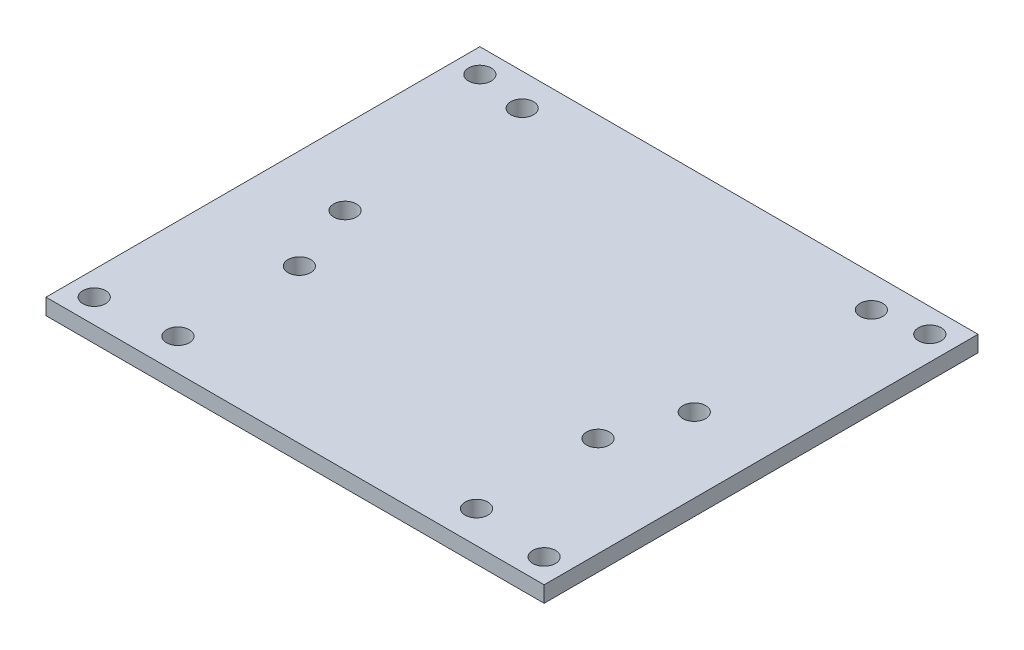
from build123d import *

# Parameters (mm, degrees)
SKETCH1_W            = 98.425
SKETCH1_H            = 85.725
BOSS_EXTRUDE1_DEPTH  = 3.175
M3_CLEARANCE_HOLE1_D = 4.5
M3_CLEARANCE_HOLE2_D = 4.5


with BuildPart() as part:
    # Sketch1 → Boss-Extrude1 (new body)
    with BuildSketch(Plane(origin=(0, 0, 0), x_dir=(1, 0, 0), z_dir=(0, 1, 0))):
        Rectangle(SKETCH1_W, SKETCH1_H)
    extrude(amount=BOSS_EXTRUDE1_DEPTH)

    # M3 Clearance Hole1 (through all)
    with Locations(Plane(origin=(-44.45, 0, 38.1), x_dir=(0, 0, -1), z_dir=(0, -1, 0))):
        with Locations((0, 0), (0, 88.9), (76.2, 0), (76.2, 88.9)):
            Hole(M3_CLEARANCE_HOLE1_D / 2)

    # M3 Clearance Hole2 (through all)
    with Locations(Plane(origin=(-29.5, 3.175, 36.5125), x_dir=(0, 0, 1), z_dir=(0, 1, 0))):
        with Locations((0, 0), (-24, 0), (-24, 59), (0, 59), (-38.025, 64), (-73.025, 64), (-73.025, -5), (-38.025, -5)):
            Hole(M3_CLEARANCE_HOLE2_D / 2)


solid = part.part
